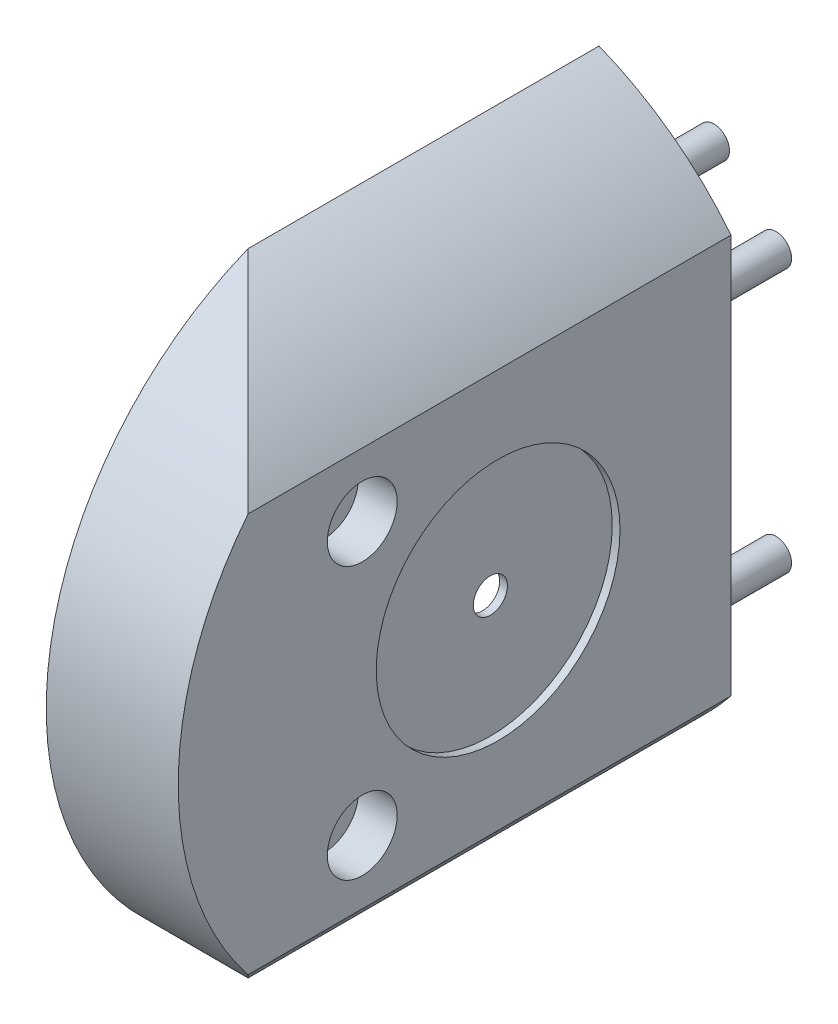
from build123d import *

# Parameters (mm, degrees)
SKETCH_1_W           = 17
SKETCH_1_H           = 82.4
EXTRUDE_1_DEPTH      = 30
EXTRUDE_2_DEPTH      = 17
CUT_EXTRUDE_1_DEPTH  = 62.2
SKETCH_4_R           = 2
EXTRUDE_3_DEPTH      = 10
SKETCH_5_R           = 20
CUT_EXTRUDE_2_DEPTH  = 15
SKETCH_6_R           = 15.7
CUT_EXTRUDE_3_DEPTH  = 1
SKETCH_7_R           = 2.2
CUT_EXTRUDE_4_DEPTH  = 1
SKETCH_8_R           = 29.2
CUT_EXTRUDE_7_DEPTH  = 30
SKETCH_9_R           = 4.5
CUT_EXTRUDE_9_DEPTH  = 5
SKETCH_10_R          = 2
CUT_EXTRUDE_10_DEPTH = 12


# Read off the part's stored shape, not the designer's step: 切除-拉伸1
with BuildPart() as part:
    # 草图1 → 凸台-拉伸1 (new body)
    with BuildSketch(Plane.XY):
        with Locations((23.7, 0)):
            Rectangle(SKETCH_1_W, SKETCH_1_H)
    extrude(amount=EXTRUDE_1_DEPTH)

    # 草图2 → 凸台-拉伸2 (add)
    with BuildSketch(Plane.ZY.offset(-15.2)):
        with BuildLine():
            Line((30, -41.2), (30, 41.2))
            ThreePointArc((30, 41.2), (71.2, 0), (30, -41.2))
        make_face()
    extrude(amount=-EXTRUDE_2_DEPTH)

    # 切除-拉伸1 outline → 切除-拉伸1 (cut)
    with BuildSketch(Plane.XY):
        with BuildLine():
            Line((32.2, -41.2), (32.2, -25.702139989))
            ThreePointArc((32.2, -25.702139989), (24.521954096, -33.107608904), (15.2, -38.293602599))
            Line((15.2, -38.293602599), (15.2, -41.2))
            Line((15.2, -41.2), (32.2, -41.2))
        make_face()
        with BuildLine():
            ThreePointArc((15.2, 38.293602599), (24.521954096, 33.107608904), (32.2, 25.702139989))
            Line((32.2, 25.702139989), (32.2, 41.2))
            Line((32.2, 41.2), (15.2, 41.2))
            Line((15.2, 41.2), (15.2, 38.293602599))
        make_face()
    extrude(amount=CUT_EXTRUDE_1_DEPTH, mode=Mode.SUBTRACT)

    # 草图4 → 凸台-拉伸3 (add)
    with BuildSketch(Plane.XY):
        with Locations((20, 25)):
            Circle(SKETCH_4_R)
        with Locations((28, 17)):
            Circle(SKETCH_4_R)
        with Locations((20, -25)):
            Circle(SKETCH_4_R)
        with Locations((28, -17)):
            Circle(SKETCH_4_R)
    extrude(amount=-EXTRUDE_3_DEPTH)

    # 草图5 → 切除-拉伸2 (cut)
    with BuildSketch(Plane.ZY.offset(-15.2)):
        with Locations(Location((30, 0, 0), (0, 0, 270))):
            Circle(SKETCH_5_R)
    extrude(amount=-CUT_EXTRUDE_2_DEPTH, mode=Mode.SUBTRACT)

    # 草图6 → 切除-拉伸3 (cut)
    with BuildSketch(Plane(origin=(32.2, 0, 0), x_dir=(0, 0, -1), z_dir=(1, 0, 0))):
        with Locations((-30, 0)):
            Circle(SKETCH_6_R)
    extrude(amount=-CUT_EXTRUDE_3_DEPTH, mode=Mode.SUBTRACT)

    # 草图7 → 切除-拉伸4 (cut)
    with BuildSketch(Plane(origin=(31.2, 0, 0), x_dir=(0, 0, -1), z_dir=(1, 0, 0))):
        with Locations((-30, 0)):
            Circle(SKETCH_7_R)
    extrude(amount=-CUT_EXTRUDE_4_DEPTH, mode=Mode.SUBTRACT)

    # 草图8 → 切除-拉伸7 (cut)
    with BuildSketch(Plane.XY):
        Circle(SKETCH_8_R)
    extrude(amount=CUT_EXTRUDE_7_DEPTH, mode=Mode.SUBTRACT)

    # 草图9 → 切除-拉伸9 (cut)
    with BuildSketch(Plane(origin=(32.2, 0, 0), x_dir=(0, 0, -1), z_dir=(1, 0, 0))):
        with Locations((-47.5, 17.5)):
            Circle(SKETCH_9_R)
        with Locations((-47.5, -17.5)):
            Circle(SKETCH_9_R)
    extrude(amount=-CUT_EXTRUDE_9_DEPTH, mode=Mode.SUBTRACT)

    # 草图10 → 切除-拉伸10 (cut)
    with BuildSketch(Plane(origin=(27.2, 0, 0), x_dir=(0, 0, -1), z_dir=(1, 0, 0))):
        with Locations((-47.5, 17.5)):
            Circle(SKETCH_10_R)
        with Locations((-47.5, -17.5)):
            Circle(SKETCH_10_R)
    extrude(amount=-CUT_EXTRUDE_10_DEPTH, mode=Mode.SUBTRACT)


solid = part.part
